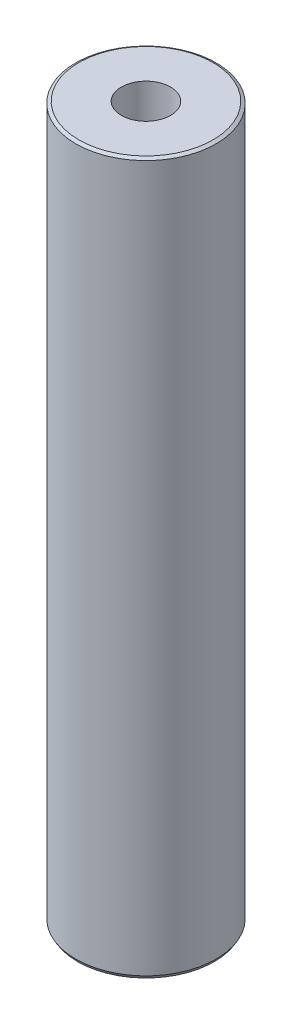
from build123d import *
from OCP.BRepFilletAPI import BRepFilletAPI_MakeChamfer

# Parameters (mm, degrees)
SKETCH1_R           = 52.5
BOSS_EXTRUDE1_DEPTH = 531.758512263
SKETCH2_R           = 18.409041087
CUT_EXTRUDE1_DEPTH  = 537.916767632
CHAMFER1_SIZE       = 1.358380491
CHAMFER1_SIZE2      = 2.352784027


with BuildPart() as part:
    # Sketch1 → Boss-Extrude1 (new body)
    with BuildSketch(Plane(origin=(0, 0, 0), x_dir=(1, 0, 0), z_dir=(0, 1, 0))):
        Circle(SKETCH1_R)
    extrude(amount=BOSS_EXTRUDE1_DEPTH)

    # Sketch2 → Cut-Extrude1 (cut, through all)
    with BuildSketch(Plane(origin=(0, 0, 0), x_dir=(1, 0, 0), z_dir=(0, 1, 0))):
        Circle(SKETCH2_R)
    extrude(amount=CUT_EXTRUDE1_DEPTH, mode=Mode.SUBTRACT)

    # Chamfer1: one chamfer whose edges measure the first distance from different faces: ONE call of the kernel's chamfer builder (chamfer() names one face for all edges)
    chamfer1_edges_1 = [part.edges().sort_by_distance(p)[0] for p in [
        (-52.5, 531.758512263, 0),
    ]]
    chamfer1_side_1 = [part.faces().sort_by_distance(p)[0] for p in [
        (-52.5, 265.879256132, 0),
    ]]
    chamfer1_edges_2 = [part.edges().sort_by_distance(p)[0] for p in [
        (-52.5, 0, 0),
    ]]
    chamfer1_side_2 = [part.faces().sort_by_distance(p)[0] for p in [
        (-51.01507576, 0, 0),
    ]]
    chamfer1 = BRepFilletAPI_MakeChamfer(part.part.solid().wrapped)
    for e in chamfer1_edges_1:
        chamfer1.Add(CHAMFER1_SIZE, CHAMFER1_SIZE2, e.wrapped, chamfer1_side_1[0].wrapped)  # the first distance lies on this face
    for e in chamfer1_edges_2:
        chamfer1.Add(CHAMFER1_SIZE, CHAMFER1_SIZE2, e.wrapped, chamfer1_side_2[0].wrapped)  # the first distance lies on this face
    add(Compound.cast(chamfer1.Shape()), mode=Mode.REPLACE)


solid = part.part
